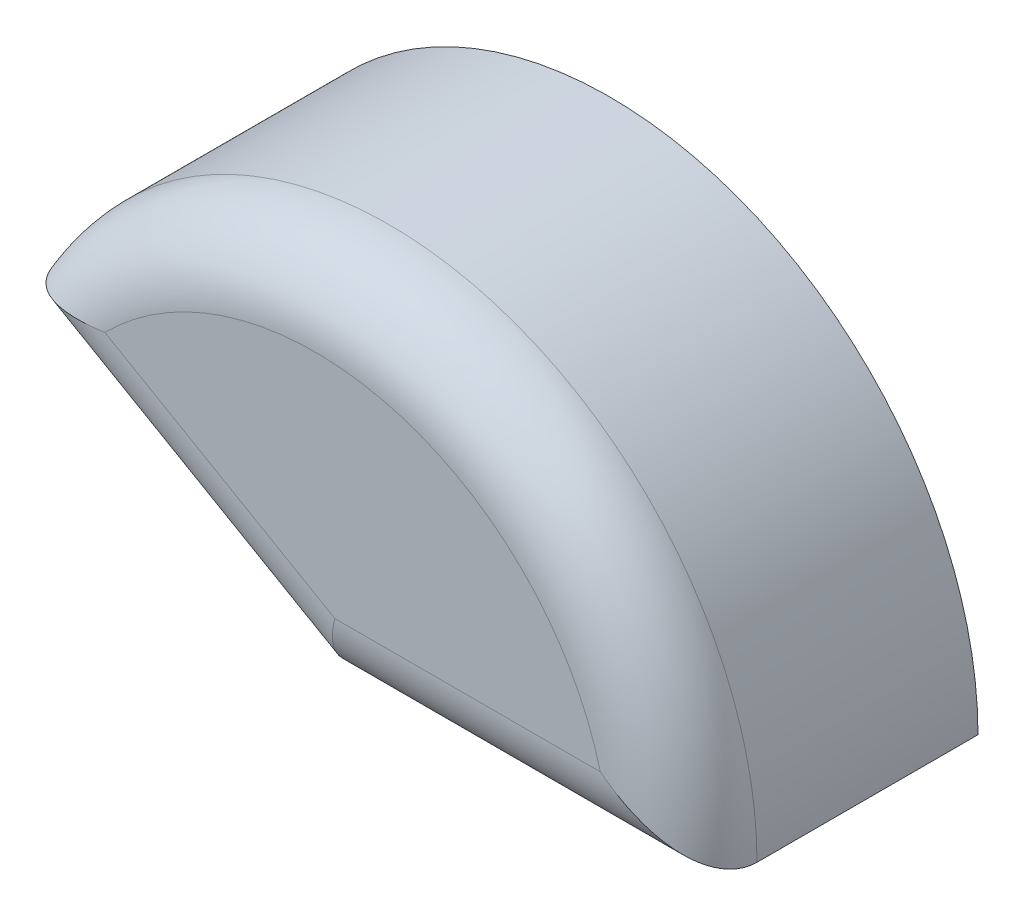
from build123d import *

# Parameters (mm, degrees)
BOSS_EXTRUDE1_DEPTH = 20
FILLET1_R           = 5


with BuildPart() as part:
    # Sketch1 → Boss-Extrude1 (new body)
    with BuildSketch(Plane.XY):
        with BuildLine():
            Line((-21.650635095, 12.5), (0, 0))
            Line((0, 0), (25, 0))
            ThreePointArc((25, 0), (6.470476128, 24.148145657), (-21.650635095, 12.5))
        make_face()
    extrude(amount=BOSS_EXTRUDE1_DEPTH)

    # Fillet1
    fillet1_edges = [part.edges().sort_by_distance(p)[0] for p in [
        (-10.825317547, 6.25, 20),
        (6.470476128, 24.148145657, 20),
        (12.5, 0, 20),
    ]]
    fillet(fillet1_edges, radius=FILLET1_R)


solid = part.part
